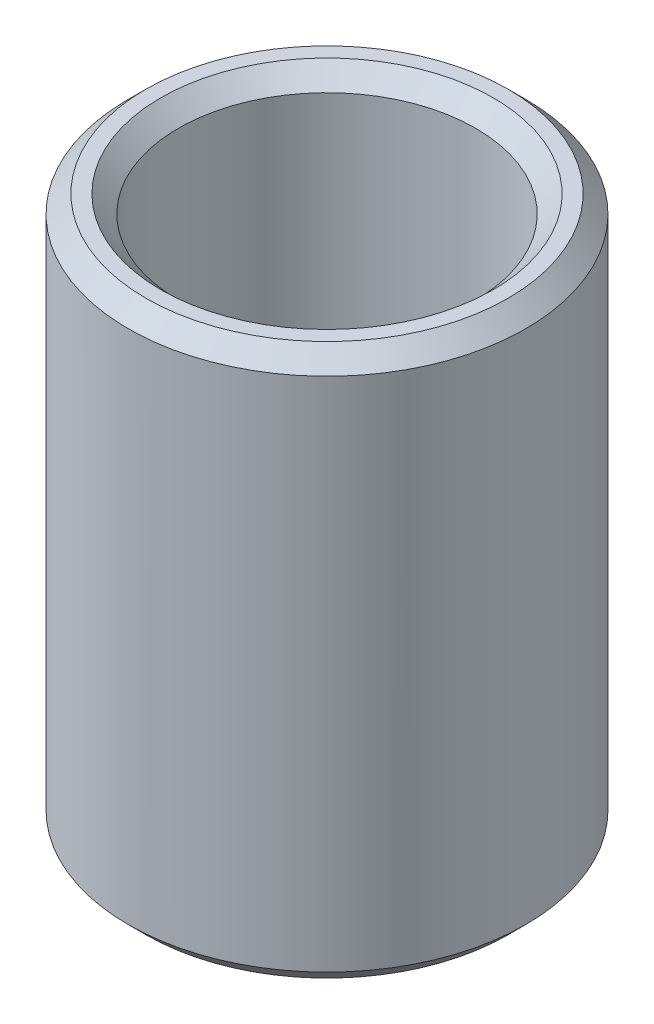
from build123d import *

# Parameters (mm, degrees)
SKETCH1_R           = 42.5
BOSS_EXTRUDE1_DEPTH = 117.910318681
SKETCH2_R           = 31.794984689
CUT_EXTRUDE1_DEPTH  = 133.345544887
CHAMFER1_SIZE       = 3.765138655


with BuildPart() as part:
    # Sketch1 → Boss-Extrude1 (new body)
    with BuildSketch(Plane(origin=(0, 0, 0), x_dir=(1, 0, 0), z_dir=(0, 1, 0))):
        Circle(SKETCH1_R)
    extrude(amount=BOSS_EXTRUDE1_DEPTH)

    # Sketch2 → Cut-Extrude1 (cut, through all)
    with BuildSketch(Plane(origin=(0, 0, 0), x_dir=(1, 0, 0), z_dir=(0, 1, 0))):
        Circle(SKETCH2_R)
    extrude(amount=CUT_EXTRUDE1_DEPTH, mode=Mode.SUBTRACT)

    # Chamfer1
    chamfer1_edges = [part.edges().sort_by_distance(p)[0] for p in [
        (-31.794984689, 117.910318681, 0),
        (-31.794984689, 0, 0),
        (-42.5, 0, 0),
        (-42.5, 117.910318681, 0),
    ]]
    chamfer(chamfer1_edges, length=CHAMFER1_SIZE)


solid = part.part
